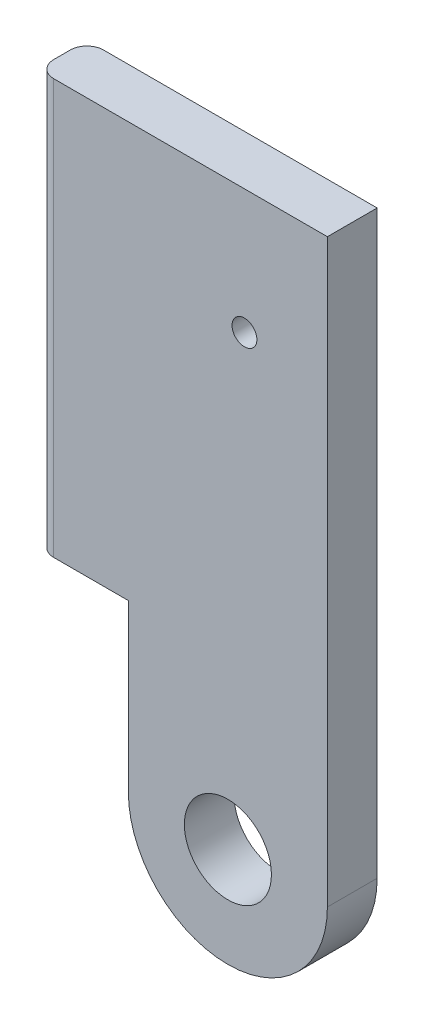
from build123d import *

# Parameters (mm, degrees)
SKETCH1_R           = 2.625
BOSS_EXTRUDE1_DEPTH = 3
VARFILLET1_R        = 1
SKETCH3_R           = 0.75
CUT_EXTRUDE1_DEPTH  = 10


with BuildPart() as part:
    # Sketch1 → Boss-Extrude1 (new body)
    with BuildSketch(Plane.XY):
        with BuildLine():
            Line((-6, 10), (-6, 0))
            ThreePointArc((-6, 0), (0, -6), (6, 0))
            Line((6, 0), (6, 35))
            Line((6, 35), (-11.5, 35))
            Line((-11.5, 35), (-11.5, 10))
            Line((-11.5, 10), (-6, 10))
        make_face()
        Circle(SKETCH1_R, mode=Mode.SUBTRACT)
    extrude(amount=BOSS_EXTRUDE1_DEPTH)

    # VarFillet1
    varfillet1_edges = [part.edges().sort_by_distance(p)[0] for p in [
        (-11.5, 22.5, 0),
        (-11.5, 22.5, 3),
    ]]
    fillet(varfillet1_edges, radius=VARFILLET1_R)

    # Sketch3 → Cut-Extrude1 (cut)
    with BuildSketch(Plane(origin=(0, 0, 0), x_dir=(-1, 0, 0), z_dir=(0, 0, -1))):
        with Locations((-1, 27.5)):
            Circle(SKETCH3_R)
    extrude(amount=-CUT_EXTRUDE1_DEPTH, mode=Mode.SUBTRACT)


solid = part.part
